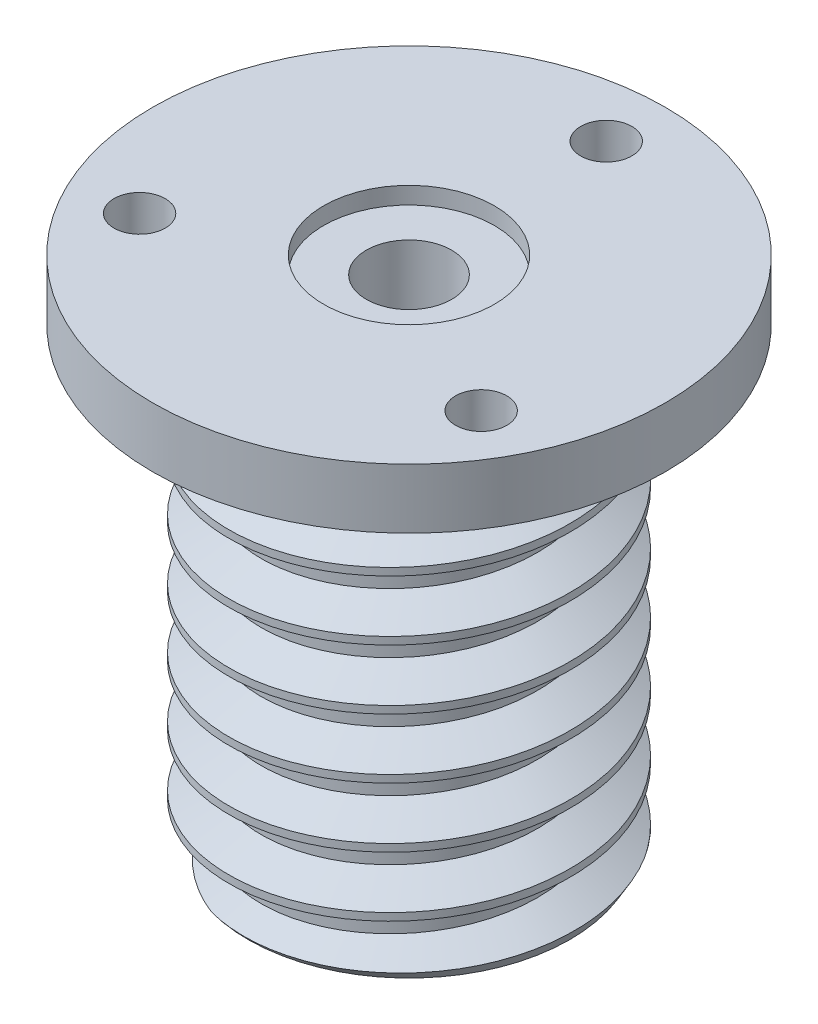
from build123d import *

# Parameters (mm, degrees)
CHAMFER1_SIZE      = 1
CHAMFER1_SIZE2     = 0.577350269
THREAD1_PITCH      = 3.5
SKETCH2_R          = 1.5
CUT_EXTRUDE1_DEPTH = 4


with BuildPart() as part:
    # Sketch1 → Revolve1 (revolve)
    with BuildSketch(Plane(origin=(0, 0, 0), x_dir=(0, 0, -1), z_dir=(1, 0, 0))):
        Polygon((15, 30), (15, 26.5), (10, 26.5), (10, 23.825), (10, 0), (5, 0), (5, 1), (2.5, 1), (2.5, 29), (5, 29), (5, 30), align=None)
    revolve(axis=Axis((0, 0, 0), (0, 1, 0)))

    # Chamfer1
    chamfer1_edges = [part.edges().sort_by_distance(p)[0] for p in [
        (0, 0, 10),
    ]]
    chamfer1_side = [part.faces().sort_by_distance(p)[0] for p in [
        (0, 13.25, 10),
    ]]
    chamfer(chamfer1_edges, length=CHAMFER1_SIZE, length2=CHAMFER1_SIZE2, reference=chamfer1_side[0])

    # Thread1: the profile of Thread Profile1 profile screwed along a right-hand helix of 7.428571 turns, 12 arcs to a turn; built about Z, then put on its axis
    thread1_z = Axis((0, 0, 0), (0, 0, 1))
    thread1_corners = [(10.0003, 0, -0.000173205), (10.0003, 0, 3.062673196), (8.105569438, 0, 1.968749995), (8.105569438, 0, 1.093749995)]
    with BuildLine(mode=Mode.PRIVATE) as thread1_profile:
        Line(thread1_corners[0], thread1_corners[1])
        Line(thread1_corners[1], thread1_corners[2])
        Line(thread1_corners[2], thread1_corners[3])
        Line(thread1_corners[3], thread1_corners[0])
    thread1_cap = Face(thread1_profile.wire())
    thread1_turn_angles = [0, 15, 30, 45, 60, 75, 90, 105, 120, 135, 150, 165, 180, 195, 210, 225, 240, 255, 270, 285, 300, 315, 330, 345, 360]
    thread1_turn_weights = [1, 0.9659258262890683, 1, 0.9659258262890683, 1, 0.9659258262890683, 1, 0.9659258262890683, 1, 0.9659258262890683, 1, 0.9659258262890683, 1, 0.9659258262890683, 1, 0.9659258262890683, 1, 0.9659258262890683, 1, 0.9659258262890683, 1, 0.9659258262890683, 1, 0.9659258262890683, 1]
    thread1_turn_rails = [Edge.make_bspline([Vector(p[0], p[1], 0).rotate(thread1_z, thread1_turn_angles[k]) / thread1_turn_weights[k] + Vector(0, 0, p[2] + THREAD1_PITCH * thread1_turn_angles[k] / 360) for k in range(25)], [0, 0, 0, 1, 1, 2, 2, 3, 3, 4, 4, 5, 5, 6, 6, 7, 7, 8, 8, 9, 9, 10, 10, 11, 11, 12, 12, 12], 2, thread1_turn_weights) for p in thread1_corners]
    thread1_turn_sides = [Face.make_surface_from_curves(thread1_turn_rails[p[0]], thread1_turn_rails[p[1]]) for p in [(0, 1), (1, 2), (2, 3), (3, 0)]]
    thread1_last_angles = [2520, 2535, 2550, 2565, 2580, 2595, 2610, 2625, 2640, 2655, 2670, 2672.142857143, 2674.285714286]
    thread1_last_weights = [1, 0.9659258262890683, 1, 0.9659258262890683, 1, 0.9659258262890683, 1, 0.9659258262890683, 1, 0.9659258262890683, 1, 0.9993007047883983, 1]
    thread1_last_rails = [Edge.make_bspline([Vector(p[0], p[1], 0).rotate(thread1_z, thread1_last_angles[k]) / thread1_last_weights[k] + Vector(0, 0, p[2] + THREAD1_PITCH * thread1_last_angles[k] / 360) for k in range(13)], [0, 0, 0, 1, 1, 2, 2, 3, 3, 4, 4, 5, 5, 6, 6, 6], 2, thread1_last_weights) for p in thread1_corners]
    thread1_last_sides = [Face.make_surface_from_curves(thread1_last_rails[p[0]], thread1_last_rails[p[1]]) for p in [(0, 1), (1, 2), (2, 3), (3, 0)]]
    thread1 = Plane(origin=(0, 26.5, 0), x_dir=(-1, 0, 0), z_dir=(0, -1, 0)) * Solid(Shell([*[p.moved(Location((0, 0, THREAD1_PITCH * i))) for i in range(7) for p in thread1_turn_sides], *thread1_last_sides, thread1_cap, thread1_cap.rotate(thread1_z, 2674.285714286).moved(Location((0, 0, THREAD1_PITCH * 2674.285714286 / 360)))]))
    add(thread1, mode=Mode.SUBTRACT)

    # Sketch2 → Cut-Extrude1 (cut)
    with BuildSketch(Plane(origin=(0, 30, 0), x_dir=(1, 0, 0), z_dir=(0, 1, 0))):
        with Locations(Location((0, 11.547005384, 0), (0, 0, 270))):
            Circle(SKETCH2_R)
        with Locations(Location((10, -5.773502692, 0), (0, 0, 270))):
            Circle(SKETCH2_R)
        with Locations(Location((-10, -5.773502692, 0), (0, 0, 270))):
            Circle(SKETCH2_R)
    extrude(amount=-CUT_EXTRUDE1_DEPTH, mode=Mode.SUBTRACT)


solid = part.part
